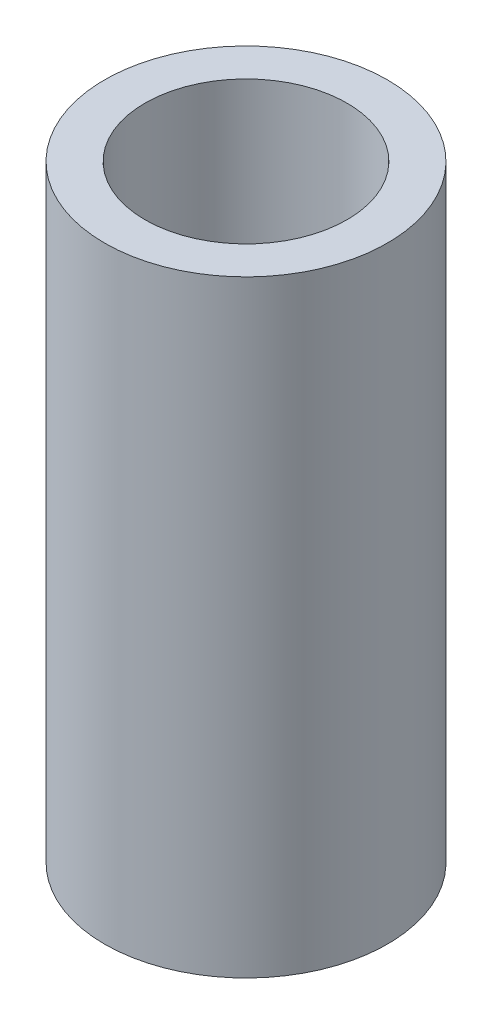
from build123d import *

# Parameters (mm, degrees)
SKETCH1_R           = 17.5
BOSS_EXTRUDE1_DEPTH = 75.139010184
SKETCH2_R           = 12.506038525
CUT_EXTRUDE1_DEPTH  = 80.109865702


with BuildPart() as part:
    # Sketch1 → Boss-Extrude1 (new body)
    with BuildSketch(Plane(origin=(0, 0, 0), x_dir=(1, 0, 0), z_dir=(0, 1, 0))):
        Circle(SKETCH1_R)
    extrude(amount=BOSS_EXTRUDE1_DEPTH)

    # Sketch2 → Cut-Extrude1 (cut, through all)
    with BuildSketch(Plane(origin=(0, 0, 0), x_dir=(1, 0, 0), z_dir=(0, 1, 0))):
        Circle(SKETCH2_R)
    extrude(amount=CUT_EXTRUDE1_DEPTH, mode=Mode.SUBTRACT)


solid = part.part
